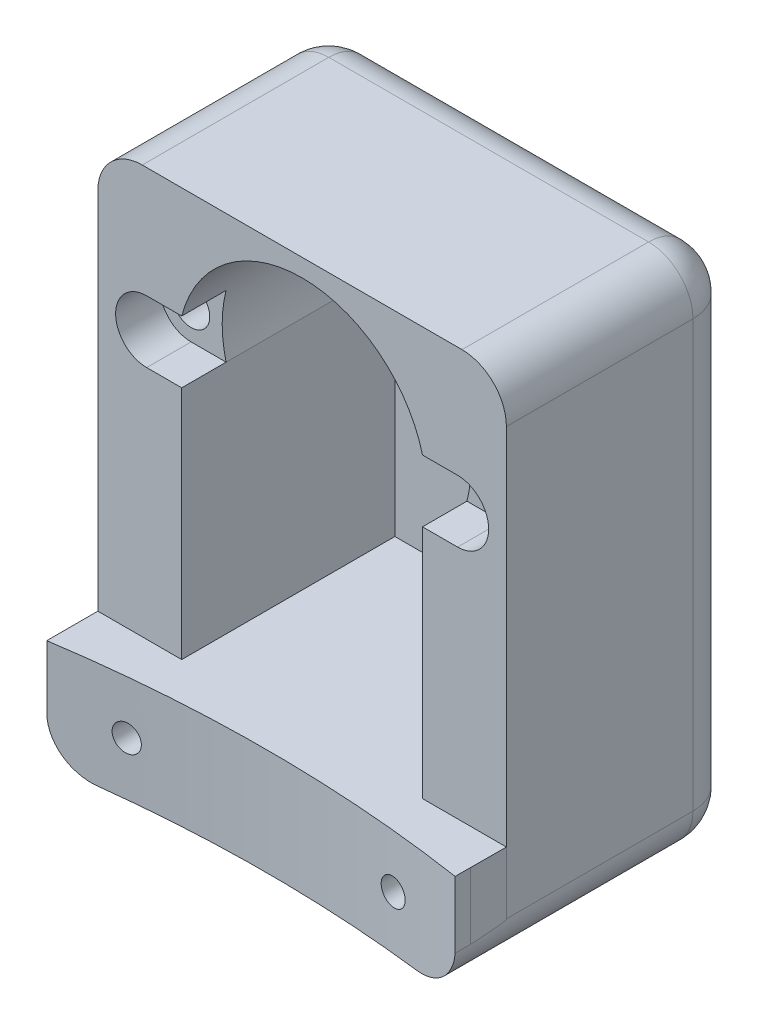
from build123d import *

# Parameters (mm, degrees)
ESQUISSE1_W             = 26
ESQUISSE1_H             = 46
BOSS_EXTRU_1_DEPTH      = 10
ESQUISSE1_5_W           = 26
ESQUISSE1_5_H           = 46
BOSS_EXTRU_2_DEPTH      = 48
ESQUISSE2_R             = 14
ESQUISSE2_R_2           = 2.5
ENL_V_MAT_EXTRU_1_DEPTH = 24
ESQUISSE2_17_R          = 2.1
ENL_V_MAT_EXTRU_2_DEPTH = 5
ESQUISSE2_18_R          = 2.1
ENL_V_MAT_EXTRU_3_DEPTH = 14
BOSS_EXTRU_7_DEPTH      = 12
CONG_1_R                = 5
CONG_2_R                = 5
ESQUISSE6_R             = 1.5
ENL_V_MAT_EXTRU_4_DEPTH = 174


with BuildPart() as part:
    # Esquisse1 → Boss.-Extru.1 (new body)
    with BuildSketch(Plane(origin=(0, 0, 0), x_dir=(0, 0, -1), z_dir=(0, 1, 0))):
        with Locations((171, 0)):
            Rectangle(ESQUISSE1_W, ESQUISSE1_H)
    extrude(amount=BOSS_EXTRU_1_DEPTH)

    # Esquisse1<5> → Boss.-Extru.2 (add)
    with BuildSketch(Plane(origin=(0, 0, 0), x_dir=(0, 0, -1), z_dir=(0, 1, 0))):
        with Locations((171, 0)):
            Rectangle(ESQUISSE1_5_W, ESQUISSE1_5_H)
    extrude(amount=-BOSS_EXTRU_2_DEPTH)

    # Esquisse2 → Enlèv. mat.-Extru.1 (cut)
    # profile 1 of 3: a face of its own
    with BuildSketch(Plane.XY.offset(-158)):
        with Locations((0, -6)):
            Circle(ESQUISSE2_R)
        with Locations((0, 2)):
            Circle(ESQUISSE2_R_2, mode=Mode.SUBTRACT)
    # profile 2 of 3: a face of its own
    with BuildSketch(Plane.XY.offset(-158)):
        with BuildLine():
            ThreePointArc((13.555441712, -9.5), (0, -20), (-13.555441712, -9.5))
            Line((-13.555441712, -9.5), (-13.555441712, -36))
            Line((-13.555441712, -36), (13.555441712, -36))
            Line((13.555441712, -36), (13.555441712, -9.5))
        make_face()
    # profile 3 of 3: a face of its own
    with BuildSketch(Plane.XY.offset(-158)):
        with Locations((0, 2)):
            Circle(ESQUISSE2_R_2)
    extrude(amount=-ENL_V_MAT_EXTRU_1_DEPTH, mode=Mode.SUBTRACT)

    # Esquisse2<17> → Enlèv. mat.-Extru.2 (cut)
    # profile 1 of 2: a face of its own
    with BuildSketch(Plane.XY.offset(-158)):
        with BuildLine():
            Line((-13.555441712, -2.5), (-17.5, -2.5))
            ThreePointArc((-17.5, -2.5), (-21, -6), (-17.5, -9.5))
            Line((-17.5, -9.5), (-13.555441712, -9.5))
            ThreePointArc((-13.555441712, -9.5), (-14, -6), (-13.555441712, -2.5))
        make_face()
        with Locations((-17.5, -6)):
            Circle(ESQUISSE2_17_R, mode=Mode.SUBTRACT)
    # profile 2 of 2: a face of its own
    with BuildSketch(Plane.XY.offset(-158)):
        with BuildLine():
            Line((17.5, -2.5), (13.555441712, -2.5))
            ThreePointArc((13.555441712, -2.5), (13.888415748, -4.235939905), (14, -6))
            ThreePointArc((14, -6), (13.888415748, -7.764060095), (13.555441712, -9.5))
            Line((13.555441712, -9.5), (17.5, -9.5))
            ThreePointArc((17.5, -9.5), (21, -6), (17.5, -2.5))
        make_face()
        with Locations((17.5, -6)):
            Circle(ESQUISSE2_17_R, mode=Mode.SUBTRACT)
    extrude(amount=-ENL_V_MAT_EXTRU_2_DEPTH, mode=Mode.SUBTRACT)

    # Esquisse2<18> → Enlèv. mat.-Extru.3 (cut)
    with BuildSketch(Plane.XY.offset(-158)):
        with Locations((-17.5, -6)):
            Circle(ESQUISSE2_18_R)
        with Locations((17.5, -6)):
            Circle(ESQUISSE2_18_R)
    extrude(amount=-ENL_V_MAT_EXTRU_3_DEPTH, mode=Mode.SUBTRACT)

    # Esquisse5 → Boss.-Extru.7 (add)
    with BuildSketch(Plane.XZ.offset(48)):
        with BuildLine():
            Line((-23, -158), (-23, -154))
            Line((-23, -154), (-23, -152.249792013))
            ThreePointArc((-23, -152.249792013), (-0.012314253, -153.999999501), (22.975654778, -152.253516723))
            Line((22.975654778, -152.253516723), (22.975654778, -154))
            Line((22.975654778, -154), (23, -158))
            Line((23, -158), (23, -184))
            Line((23, -184), (-23, -184))
            Line((-23, -184), (-23, -158))
        make_face()
    extrude(amount=-BOSS_EXTRU_7_DEPTH)

    # Congé1
    cong_1_edges = [part.edges().sort_by_distance(p)[0] for p in [
        (23, 10, -171),
        (0, 10, -184),
        (23, -19, -184),
    ]]
    fillet(cong_1_edges, radius=CONG_1_R)

    # Congé2
    # the kernel refuses this fillet: 5 mm, written as the material it takes off along each edge
    with BuildSketch(Plane(origin=(-18, -43, -179), x_dir=(-1, 0, 0), z_dir=(0, -1, 0))) as cong_2_piece_1_section:
        Polygon((0, 0), (CONG_2_R * 1.02, 0), (CONG_2_R * 1.02, CONG_2_R * 1.02), (0, CONG_2_R * 1.02), align=None)
    cong_2_piece_1 = extrude(amount=CONG_2_R * 1.02, mode=Mode.PRIVATE)
    cong_2_piece_1 = cong_2_piece_1 - Plane(origin=(-18, -43, -179), x_dir=(0.7071067811865475, 0, 0.7071067811865475), z_dir=(0, -1, 0)) * Sphere(CONG_2_R, mode=Mode.PRIVATE)
    add(cong_2_piece_1, mode=Mode.SUBTRACT)
    with BuildSketch(Plane(origin=(18, -48, -179), x_dir=(0, 0, -1), z_dir=(-1, 0, 0))) as cong_2_piece_2:
        with BuildLine():
            CenterArc((5 - CONG_2_R, -CONG_2_R), CONG_2_R, 0, 90)
            Line((5 - CONG_2_R, 0), (5, 0))
            Line((5, 0), (5, -CONG_2_R))
        make_face()
    revolve(axis=Axis((18, -48, -179), (0, -1, 0)), revolution_arc=90, mode=Mode.SUBTRACT)
    with BuildSketch(Plane(origin=(-23, 5, -179), x_dir=(0, 1, 0), z_dir=(0, 0, 1))) as cong_2_piece_3:
        with BuildLine():
            CenterArc((5 - CONG_2_R, -CONG_2_R), CONG_2_R, 0, 90)
            Line((5, -CONG_2_R), (5, 0))
            Line((5, 0), (5 - CONG_2_R, 0))
        make_face()
    revolve(axis=Axis((-23, 5, -179), (-1, 0, 0)), revolution_arc=90, mode=Mode.SUBTRACT)
    with BuildSketch(Plane(origin=(-23, -48, -179), x_dir=(0, 1, 0), z_dir=(0, 0, 1))) as cong_2_piece_4:
        with BuildLine():
            CenterArc((CONG_2_R, -CONG_2_R), CONG_2_R, 90, 90)
            Line((0, -CONG_2_R), (0, 0))
            Line((0, 0), (CONG_2_R, 0))
        make_face()
    extrude(amount=39.250207987, mode=Mode.SUBTRACT)
    with BuildSketch(Plane(origin=(23, -48, -145.5), x_dir=(0, 1, 0), z_dir=(0, 0, -1)), Plane(origin=(-23, 10, -179), x_dir=(1, 0, 0), z_dir=(0, 0, 1))) as cong_2_piece_5:
        with BuildLine():
            CenterArc((CONG_2_R, -CONG_2_R), CONG_2_R, 90, 90)
            Line((0, -CONG_2_R), (0, 0))
            Line((0, 0), (CONG_2_R, 0))
        make_face()
    extrude(amount=33.5, mode=Mode.SUBTRACT)
    with BuildSketch(Plane(origin=(18, -48, -184), x_dir=(0, 0, 1), z_dir=(-1, 0, 0))) as cong_2_piece_6:
        with BuildLine():
            CenterArc((CONG_2_R, CONG_2_R), CONG_2_R, 180, 90)
            Line((0, CONG_2_R), (0, 0))
            Line((0, 0), (CONG_2_R, 0))
        make_face()
    extrude(amount=36, mode=Mode.SUBTRACT)
    with BuildSketch(Plane(origin=(-23, 5, -184), x_dir=(0, 0, 1), z_dir=(0, -1, 0))) as cong_2_piece_7:
        with BuildLine():
            CenterArc((CONG_2_R, -CONG_2_R), CONG_2_R, 90, 90)
            Line((0, -CONG_2_R), (0, 0))
            Line((0, 0), (CONG_2_R, 0))
        make_face()
    extrude(amount=48, mode=Mode.SUBTRACT)

    # Esquisse6 → Enlèv. mat.-Extru.4 (cut)
    with BuildSketch(Plane.XY):
        with Locations((-15, -42)):
            Circle(ESQUISSE6_R)
        with Locations((15, -42)):
            Circle(ESQUISSE6_R)
    extrude(amount=-ENL_V_MAT_EXTRU_4_DEPTH, mode=Mode.SUBTRACT)


solid = part.part
